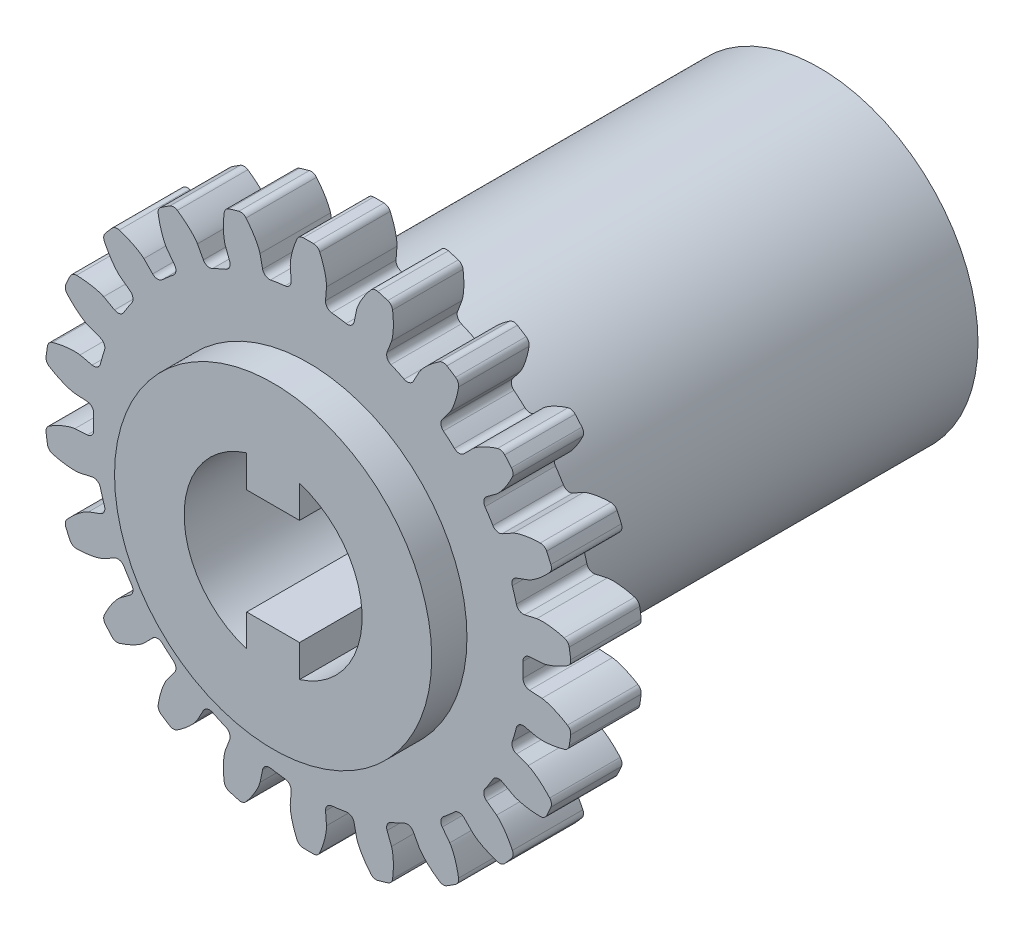
from build123d import *

# Parameters (mm, degrees)
SKETCH1_R                = 15
BOSS_EXTRUDE1_DEPTH      = 4
CUT_EXTRUDE1_DEPTH       = 22.587033145
FILLET1_R                = 0.393380952
CIRPATTERN1_COUNT        = 22
FILLET1_OF_CIRPATTERN1_R = 0.393380952
BOSS_EXTRUDE2_DEPTH      = 6
BOSS_EXTRUDE2_DEPTH_BACK = 25
SKETCH4_R                = 9
CUT_EXTRUDE2_DEPTH       = 33.736582297
CUT_EXTRUDE2_DEPTH_BACK  = 33.736582297


with BuildPart() as part:
    # Sketch1 → Boss-Extrude1 (new body)
    with BuildSketch(Plane.XY):
        Circle(SKETCH1_R)
    extrude(amount=BOSS_EXTRUDE1_DEPTH)

    # Sketch2 → Cut-Extrude1 (cut, through all)
    with BuildSketch(Plane.XY.offset(4)):
        with BuildLine():
            Line((13.253216751, 0.866002139), (12.16156466, 0.794670547))
            ThreePointArc((12.16156466, 0.794670547), (12.1875, 0), (12.16156466, -0.794670547))
            Line((12.16156466, -0.794670547), (13.253216751, -0.866002139))
            add(Edge.make_bspline(
                [(13.253216751, -0.866002139), (13.255914444, -0.86620852), (13.263474218, -0.866880195), (13.277739642, -0.868516575), (13.30097514, -0.871707102), (13.330515261, -0.876537038), (13.368614078, -0.883657416), (13.413382125, -0.893173554), (13.462454053, -0.904812767), (13.515695893, -0.918749707), (13.568675459, -0.933779607), (13.621390614, -0.949819773), (13.673776952, -0.966742157), (13.737076541, -0.988355069), (13.812755257, -1.015819503), (13.900866038, -1.050174504), (14.000372931, -1.0917951), (14.101307947, -1.13705027), (14.200224855, -1.18391075), (14.299678297, -1.233930441), (14.395556748, -1.284220907), (14.494615468, -1.339189637), (14.585783721, -1.391318403), (14.687311571, -1.452738768), (14.769068226, -1.503186874), (14.852992917, -1.557811145), (14.893760691, -1.584767509), (14.914561972, -1.598699838)],
                knots=[0, 0, 0, 0, 0, 0.005376749, 0.015083688, 0.02853182, 0.04661014, 0.064854849, 0.092110526, 0.119476176, 0.146842496, 0.174208854, 0.201574956, 0.228941013, 0.256307345, 0.307035032, 0.361767352, 0.416499661, 0.471231937, 0.525964282, 0.580696616, 0.635428982, 0.690161387, 0.744893688, 0.799626082, 0.854358407, 0.909090914, 0.909090914, 0.909090914, 0.909090914, 0.909090914], degree=4))
            ThreePointArc((14.914561972, -1.598699838), (14.978625264, -0.800490604), (15, 0))
            ThreePointArc((15, 0), (14.978625264, 0.800490604), (14.914561972, 1.598699838))
            add(Edge.make_bspline(
                [(13.253216751, 0.866002139), (13.255914444, 0.86620852), (13.263474218, 0.866880195), (13.277739642, 0.868516575), (13.30097514, 0.871707102), (13.330515261, 0.876537038), (13.368614078, 0.883657416), (13.413382125, 0.893173554), (13.462454053, 0.904812767), (13.515695893, 0.918749707), (13.568675459, 0.933779607), (13.621390614, 0.949819773), (13.673776952, 0.966742157), (13.737076541, 0.988355069), (13.812755257, 1.015819503), (13.900866038, 1.050174504), (14.000372931, 1.0917951), (14.101307947, 1.13705027), (14.200224855, 1.18391075), (14.299678297, 1.233930441), (14.395556748, 1.284220907), (14.494615468, 1.339189637), (14.585783721, 1.391318403), (14.687311571, 1.452738768), (14.769068226, 1.503186874), (14.852992917, 1.557811145), (14.893760691, 1.584767509), (14.914561972, 1.598699838)],
                knots=[0, 0, 0, 0, 0, 0.005376749, 0.015083688, 0.02853182, 0.04661014, 0.064854849, 0.092110526, 0.119476176, 0.146842496, 0.174208854, 0.201574956, 0.228941013, 0.256307345, 0.307035032, 0.361767352, 0.416499661, 0.471231937, 0.525964282, 0.580696616, 0.635428982, 0.690161387, 0.744893688, 0.799626082, 0.854358407, 0.909090914, 0.909090914, 0.909090914, 0.909090914, 0.909090914], degree=4))
        make_face()
    cut_extrude1 = extrude(amount=-CUT_EXTRUDE1_DEPTH, mode=Mode.SUBTRACT)

    # Fillet1
    fillet1_edges = [part.edges().sort_by_distance(p)[0] for p in [
        (12.16156466, -0.794670547, 2),
        (12.16156466, 0.794670547, 2),
        (14.914561972, -1.598699838, 2),
        (14.914561972, 1.598699838, 2),
    ]]
    fillet(fillet1_edges, radius=FILLET1_R)

    # CirPattern1: Cut-Extrude1 ×22 about axis
    cirpattern1_axis = Axis((0, 0, 0), (0, 0, 1))
    for i in range(1, CIRPATTERN1_COUNT):
        add(cut_extrude1.rotate(cirpattern1_axis, i * 360 / CIRPATTERN1_COUNT), mode=Mode.SUBTRACT)

    # Fillet1 of CirPattern1
    fillet1_of_cirpattern1_edges = [part.edges().sort_by_distance(p)[0] for p in [
        (11.892820404, 2.6638279, 2),
        (11.445051274, 4.188789513, 2),
        (14.76082321, 2.667976417, 2),
        (13.860011624, 5.73585894, 2),
        (10.660590569, 5.906518854, 2),
        (9.8013279, 7.243557664, 2),
        (13.411250337, 6.71850909, 2),
        (11.682605562, 9.408332864, 2),
        (8.564703087, 8.670698777, 2),
        (7.363559231, 9.711495853, 2),
        (10.975177722, 10.224748113, 2),
        (8.558744277, 12.318599612, 2),
        (5.774954297, 10.732430252, 2),
        (4.329238786, 11.392666404, 2),
        (7.64996148, 12.902638853, 2),
        (4.741504432, 14.230886681, 2),
        (2.517353055, 11.924684057, 2),
        (0.944189161, 12.150870877, 2),
        (3.704990854, 14.535234528, 2),
        (0.540136096, 14.990271945, 2),
        (-0.944189161, 12.150870877, 2),
        (-2.517353055, 11.924684057, 2),
        (-0.540136096, 14.990271945, 2),
        (-3.704990854, 14.535234528, 2),
        (-4.329238786, 11.392666404, 2),
        (-5.774954297, 10.732430252, 2),
        (-4.741504432, 14.230886681, 2),
        (-7.64996148, 12.902638853, 2),
        (-7.363559231, 9.711495853, 2),
        (-8.564703087, 8.670698777, 2),
        (-8.558744277, 12.318599612, 2),
        (-10.975177722, 10.224748113, 2),
        (-9.8013279, 7.243557664, 2),
        (-10.660590569, 5.906518854, 2),
        (-11.682605562, 9.408332864, 2),
        (-13.411250337, 6.71850909, 2),
        (-11.445051274, 4.188789513, 2),
        (-11.892820404, 2.6638279, 2),
        (-13.860011624, 5.73585894, 2),
        (-14.76082321, 2.667976417, 2),
        (-12.16156466, 0.794670547, 2),
        (-12.16156466, -0.794670547, 2),
        (-14.914561972, 1.598699838, 2),
        (-14.914561972, -1.598699838, 2),
        (-11.892820404, -2.6638279, 2),
        (-11.445051274, -4.188789513, 2),
        (-14.76082321, -2.667976417, 2),
        (-13.860011624, -5.73585894, 2),
        (-10.660590569, -5.906518854, 2),
        (-9.8013279, -7.243557664, 2),
        (-13.411250337, -6.71850909, 2),
        (-11.682605562, -9.408332864, 2),
        (-8.564703087, -8.670698777, 2),
        (-7.363559231, -9.711495853, 2),
        (-10.975177722, -10.224748113, 2),
        (-8.558744277, -12.318599612, 2),
        (-5.774954297, -10.732430252, 2),
        (-4.329238786, -11.392666404, 2),
        (-7.64996148, -12.902638853, 2),
        (-4.741504432, -14.230886681, 2),
        (-2.517353055, -11.924684057, 2),
        (-0.944189161, -12.150870877, 2),
        (-3.704990854, -14.535234528, 2),
        (-0.540136096, -14.990271945, 2),
        (0.944189161, -12.150870877, 2),
        (2.517353055, -11.924684057, 2),
        (0.540136096, -14.990271945, 2),
        (3.704990854, -14.535234528, 2),
        (4.329238786, -11.392666404, 2),
        (5.774954297, -10.732430252, 2),
        (4.741504432, -14.230886681, 2),
        (7.64996148, -12.902638853, 2),
        (7.363559231, -9.711495853, 2),
        (8.564703087, -8.670698777, 2),
        (8.558744277, -12.318599612, 2),
        (10.975177722, -10.224748113, 2),
        (9.8013279, -7.243557664, 2),
        (10.660590569, -5.906518854, 2),
        (11.682605562, -9.408332864, 2),
        (13.411250337, -6.71850909, 2),
        (11.445051274, -4.188789513, 2),
        (11.892820404, -2.6638279, 2),
        (13.860011624, -5.73585894, 2),
        (14.76082321, -2.667976417, 2),
    ]]
    fillet(fillet1_of_cirpattern1_edges, radius=FILLET1_OF_CIRPATTERN1_R)

    # Sketch4 → Boss-Extrude2 (add, two sides: drawn at the far end of the back side and taken through both)
    with BuildSketch(Plane.XY.offset(-BOSS_EXTRUDE2_DEPTH_BACK)):
        Circle(SKETCH4_R)
    extrude(amount=BOSS_EXTRUDE2_DEPTH + BOSS_EXTRUDE2_DEPTH_BACK)

    # Sketch3 → Cut-Extrude2 (cut, two sides: drawn at the far end of the back side and taken through both)
    with BuildSketch(Plane.XY.offset(-CUT_EXTRUDE2_DEPTH_BACK)):
        with BuildLine():
            Line((-1.5, 3), (-1.5, 4.822084611))
            ThreePointArc((-1.5, 4.822084611), (-5.05, 0), (-1.5, -4.822084611))
            Line((-1.5, -4.822084611), (-1.5, -3))
            Line((-1.5, -3), (1.5, -3))
            Line((1.5, -3), (1.5, -4.822084611))
            ThreePointArc((1.5, -4.822084611), (4.0667862, -2.993952237), (5.05, 0))
            ThreePointArc((5.05, 0), (4.0667862, 2.993952237), (1.5, 4.822084611))
            Line((1.5, 4.822084611), (1.5, 3))
            Line((1.5, 3), (-1.5, 3))
        make_face()
    extrude(amount=CUT_EXTRUDE2_DEPTH + CUT_EXTRUDE2_DEPTH_BACK, mode=Mode.SUBTRACT)


solid = part.part
